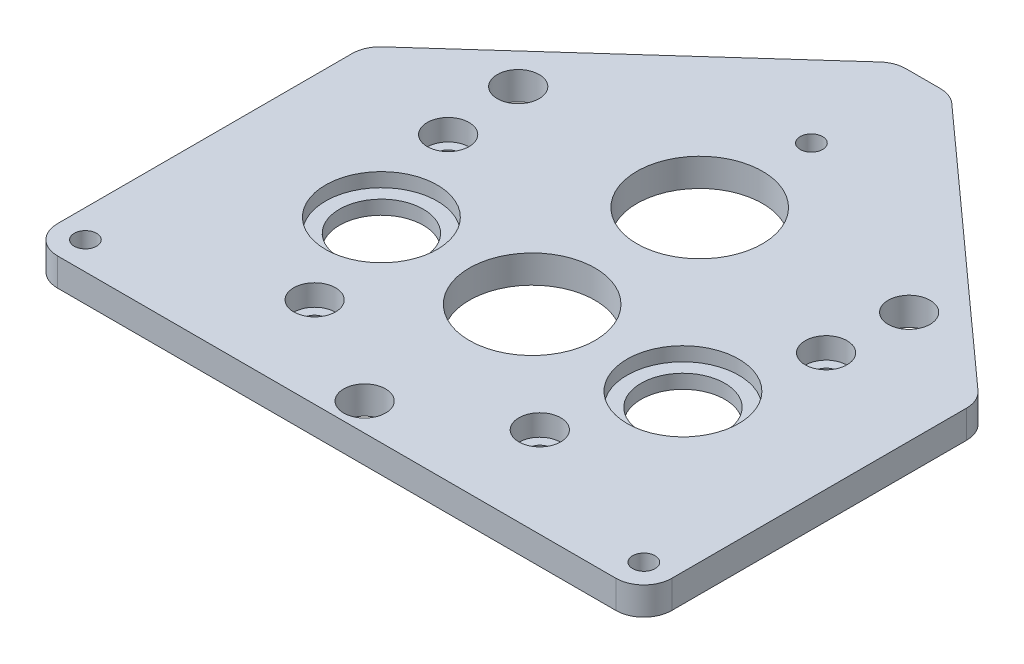
from build123d import *

# Parameters (mm, degrees)
BOSS_EXTRUDE1_DEPTH                             = 6.35
SKETCH2_R                                       = 9.525
MOTOR_SHAFT_HOLES_DEPTH                         = 135.10382172
SKETCH3_R                                       = 14.2875
FIRST_BEARING_HOLE_DEPTH                        = 135.10382172
SKETCH4_R                                       = 12.7
PINION_CLEARANCE_DEPTH                          = 3.175
SKETCH5_R                                       = 14.2875
CUT_EXTRUDE1_DEPTH                              = 135.10382172
CBORE_FOR_10_SOCKET_HEAD_CAP_SCREW1_D           = 5.1054
CBORE_FOR_10_SOCKET_HEAD_CAP_SCREW1_CBORE_D     = 9.525
CBORE_FOR_10_SOCKET_HEAD_CAP_SCREW1_CBORE_DEPTH = 4.826
F_10_CLEARANCE_HOLE1_D                          = 5.1054
FILLET1_R                                       = 6.35
SKETCH11_R                                      = 4.7625
CUT_EXTRUDE2_DEPTH                              = 50.8


with BuildPart() as part:
    # Sketch1 → Boss-Extrude1 (new body)
    with BuildSketch(Plane(origin=(0, 0, 0), x_dir=(1, 0, 0), z_dir=(0, 1, 0))):
        Polygon((69.85, -19.05), (69.85, 57.15), (6.35, 114.3), (-6.35, 114.3), (-69.85, 57.15), (-69.85, -19.05), align=None)
    extrude(amount=BOSS_EXTRUDE1_DEPTH)

    # Sketch2 → Motor Shaft Holes (cut, through all)
    with BuildSketch(Plane(origin=(0, 6.35, 0), x_dir=(1, 0, 0), z_dir=(0, 1, 0))):
        with Locations((-34.29, 25.4)):
            Circle(SKETCH2_R)
        with Locations((34.29, 25.4)):
            Circle(SKETCH2_R)
    extrude(amount=-MOTOR_SHAFT_HOLES_DEPTH, mode=Mode.SUBTRACT)

    # Sketch3 → First Bearing Hole (cut, through all)
    with BuildSketch(Plane(origin=(0, 6.35, 0), x_dir=(1, 0, 0), z_dir=(0, 1, 0))):
        with Locations((0, 25.4)):
            Circle(SKETCH3_R)
    extrude(amount=-FIRST_BEARING_HOLE_DEPTH, mode=Mode.SUBTRACT)

    # Sketch4 → Pinion Clearance (cut)
    with BuildSketch(Plane(origin=(0, 6.35, 0), x_dir=(1, 0, 0), z_dir=(0, 1, 0))):
        with Locations((-34.29, 25.4)):
            Circle(SKETCH4_R)
        with Locations((34.29, 25.4)):
            Circle(SKETCH4_R)
    extrude(amount=-PINION_CLEARANCE_DEPTH, mode=Mode.SUBTRACT)

    # Sketch5 → Cut-Extrude1 (cut, through all)
    with BuildSketch(Plane(origin=(0, 6.35, 0), x_dir=(1, 0, 0), z_dir=(0, 1, 0))):
        with Locations((0, 63.5)):
            Circle(SKETCH5_R)
    extrude(amount=-CUT_EXTRUDE1_DEPTH, mode=Mode.SUBTRACT)

    # CBORE for #10 Socket Head Cap Screw1 (through all)
    with Locations(Plane(origin=(0, 6.35, 0), x_dir=(1, 0, 0), z_dir=(0, 1, 0))):
        with Locations((-42.97731164, 49.268192568), (-25.60268836, 1.531807432)):
            cbore_for_10_socket_head_cap_screw1 = CounterBoreHole(CBORE_FOR_10_SOCKET_HEAD_CAP_SCREW1_D / 2, CBORE_FOR_10_SOCKET_HEAD_CAP_SCREW1_CBORE_D / 2, CBORE_FOR_10_SOCKET_HEAD_CAP_SCREW1_CBORE_DEPTH)

    # Mirror1: CBORE for #10 Socket Head Cap Screw1 across plane
    add(cbore_for_10_socket_head_cap_screw1.mirror(Plane(origin=(0, 0, 0), x_dir=(0, 0, 1), z_dir=(1, 0, 0))), mode=Mode.SUBTRACT)

    # #10 Clearance Hole1 (through all)
    with Locations(Plane(origin=(0, 34.925, 19.05), x_dir=(1, 0, 0), z_dir=(0, 1, 0))):
        with Locations((-63.5, 6.35), (63.5, 6.35), (0, 107.95)):
            Hole(F_10_CLEARANCE_HOLE1_D / 2)

    # Fillet1
    fillet1_edges = [part.edges().sort_by_distance(p)[0] for p in [
        (-69.85, 3.175, -57.15),
        (-6.35, 3.175, -114.3),
        (6.35, 3.175, -114.3),
        (69.85, 3.175, -57.15),
        (69.85, 3.175, 19.05),
        (-69.85, 3.175, 19.05),
    ]]
    fillet(fillet1_edges, radius=FILLET1_R)

    # Sketch11 → Cut-Extrude2 (cut)
    with BuildSketch(Plane(origin=(0, 0, 19.05), x_dir=(-1, 0, 0), z_dir=(0, -1, 0))):
        with Locations((-44.45, 85.725)):
            Circle(SKETCH11_R)
        with Locations((44.45, 85.725)):
            Circle(SKETCH11_R)
        with Locations((0, 6.35)):
            Circle(SKETCH11_R)
    extrude(amount=-CUT_EXTRUDE2_DEPTH, mode=Mode.SUBTRACT)


solid = part.part
